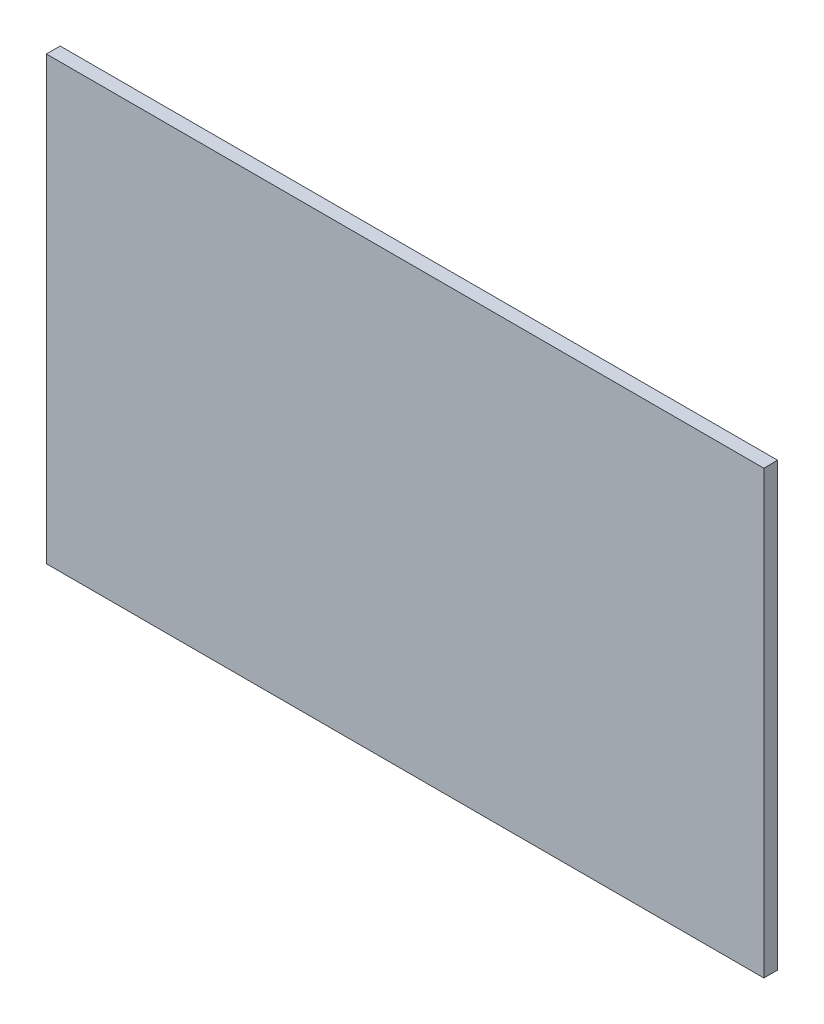
from build123d import *

# Parameters (mm, degrees)
SKETCH1_W           = 330.2
SKETCH1_H           = 203.2
BOSS_EXTRUDE1_DEPTH = 3.175


with BuildPart() as part:
    # Sketch1 → Boss-Extrude1 (new, symmetric)
    with BuildSketch(Plane.XY):
        Rectangle(SKETCH1_W, SKETCH1_H)
    extrude(amount=BOSS_EXTRUDE1_DEPTH, both=True)


solid = part.part
